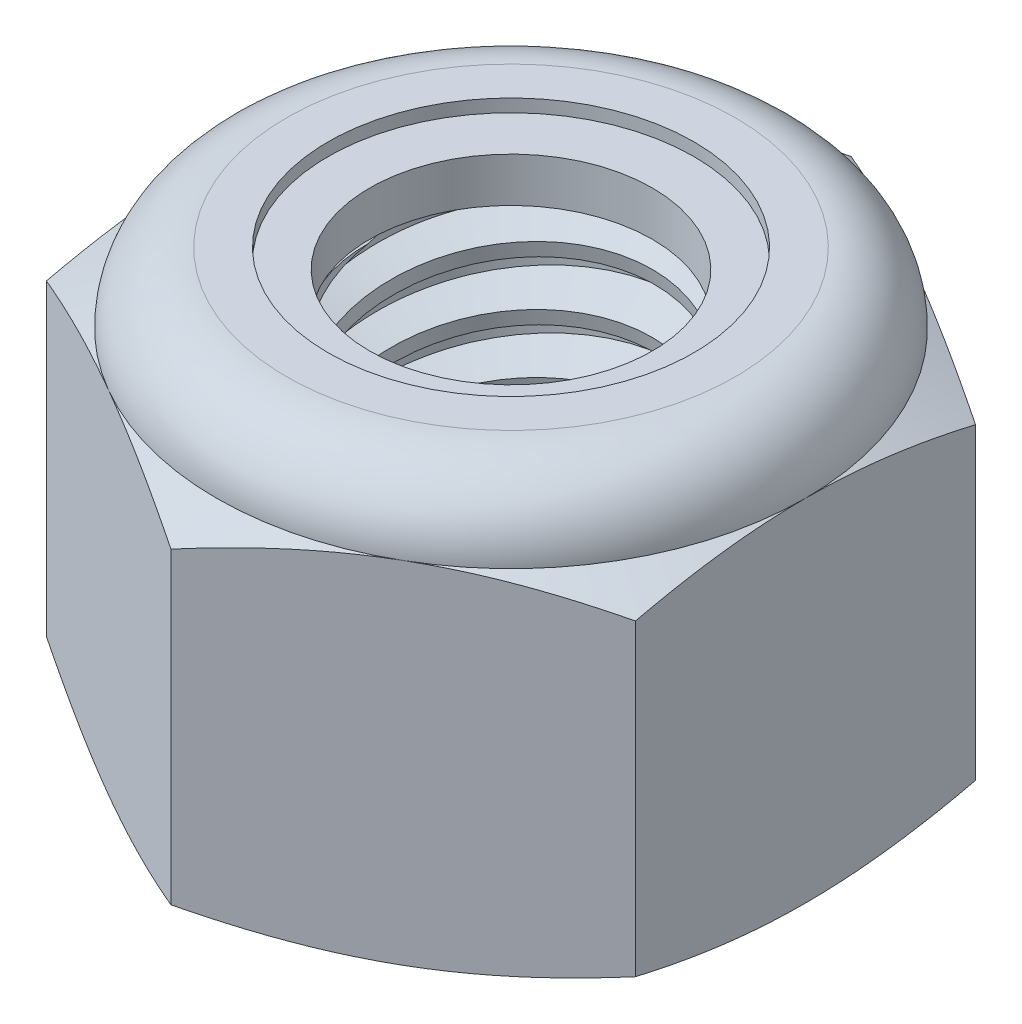
from build123d import *

# Parameters (mm, degrees)
EXTRUDE1_DEPTH       = 5
SKETCH2_W            = 2
SKETCH2_H            = 5
LPATTERN1_COUNT      = 7
LPATTERN1_PITCH      = 0.7
LPATTERN1_COUNT_DIR2 = 2
LPATTERN1_PITCH_DIR2 = 0.7


with BuildPart() as part:
    # Sketch1 → Extrude1 (new body)
    with BuildSketch(Plane(origin=(0, 0, 0), x_dir=(1, 0, 0), z_dir=(0, 1, 0))):
        Polygon((0, 4.041451884), (-3.5, 2.020725942), (-3.5, -2.020725942), (0, -4.041451884), (3.5, -2.020725942), (3.5, 2.020725942), align=None)
    extrude(amount=EXTRUDE1_DEPTH)

    # Sketch4 → Cut-Revolve2 (revolve, cut)
    with BuildSketch(Plane(origin=(0, 0, 0), x_dir=(0, 0, -1), z_dir=(1, 0, 0))):
        Polygon((0, 5), (2, 5), (1.679577111, 4.850584353), (1.679577111, 0.149415647), (2, 0), (0, 0), align=None)
    revolve(axis=Axis((0, 5, 0), (0, 1, 0)), mode=Mode.SUBTRACT)


with BuildPart() as body_2:
    # Sketch2 → Revolve1 (revolve)
    with BuildSketch(Plane(origin=(0, 0, 0), x_dir=(0, 0, -1), z_dir=(1, 0, 0))):
        with Locations((1, 2.5)):
            Rectangle(SKETCH2_W, SKETCH2_H)
    revolve(axis=Axis((0, -2, 0), (0, 1, 0)))

    # Sketch3 → Cut-Revolve1 (revolve, cut)
    with BuildSketch(Plane(origin=(0, 0, 0), x_dir=(0, 0, -1), z_dir=(1, 0, 0))):
        Polygon((2.015083279, 4.913809834), (2.120666232, 4.310478673), (1.709743669, 4.460641574), (1.679577111, 4.633021905), align=None)
    cut_revolve1 = revolve(axis=Axis((0, 5, 0.13120342), (0, -0.9850304671557042, -0.17238033175224862)), mode=Mode.SUBTRACT)

    # LPattern1: Cut-Revolve1 7 × 2
    with Locations(*[Vector(0, -1, 0) * (i * LPATTERN1_PITCH) + Vector(0, 1, 0) * (j * LPATTERN1_PITCH_DIR2) for i in range(LPATTERN1_COUNT) for j in range(LPATTERN1_COUNT_DIR2) if (i, j) != (0, 0)]):
        add(cut_revolve1, mode=Mode.SUBTRACT)


with BuildPart() as part_1:
    add(part.part)

    # Combine1: cut body 2
    add(body_2.part, mode=Mode.SUBTRACT)

    # Sketch5 → Cut-Revolve3 (revolve, cut)
    with BuildSketch(Plane(origin=(0, 0, 0), x_dir=(0, 0, -1), z_dir=(1, 0, 0))):
        with BuildLine():
            Line((0, 0), (3.5, 0))
            Line((3.5, 0), (4.041451884, 0.25248316))
            Line((4.041451884, 0.25248316), (4.041451884, 3.914183506))
            Line((4.041451884, 3.914183506), (3.5, 4.166666667))
            ThreePointArc((3.5, 4.166666667), (3.255922318, 4.755922318), (2.666666667, 5))
            Line((2.666666667, 5), (2.666666667, 6.27))
            Line((2.666666667, 6.27), (5.311451884, 6.27))
            Line((5.311451884, 6.27), (5.311451884, -1.27))
            Line((5.311451884, -1.27), (0, -1.27))
            Line((0, -1.27), (0, 0))
        make_face()
    revolve(axis=Axis((0, 0, 0), (0, 1, 0)), mode=Mode.SUBTRACT)

    # Sketch6 → Cut-Revolve4 (revolve, cut)
    with BuildSketch(Plane(origin=(0, 0, 0), x_dir=(0, 0, -1), z_dir=(1, 0, 0))):
        with BuildLine():
            Line((0, 4.166666667), (3.3476, 4.166666667))
            ThreePointArc((3.3476, 4.166666667), (3.148159244, 4.648159244), (2.666666667, 4.8476))
            Line((2.666666667, 4.8476), (2.173121889, 4.8476))
            Line((2.173121889, 4.8476), (2.173121889, 6.27))
            Line((2.173121889, 6.27), (0, 6.27))
            Line((0, 6.27), (0, 4.166666667))
        make_face()
    revolve(axis=Axis((0, 6.27, 0), (0, 1, 0)), mode=Mode.SUBTRACT)


with BuildPart() as body_2_2:
    # Sketch7 → Revolve2 (revolve)
    with BuildSketch(Plane(origin=(0, 0, 0), x_dir=(0, 0, -1), z_dir=(1, 0, 0))):
        with BuildLine():
            Line((1.679577111, 4.242866667), (3.266579964, 4.242866667))
            ThreePointArc((3.266579964, 4.242866667), (3.066430175, 4.620419399), (2.666666667, 4.7714))
            Line((2.666666667, 4.7714), (1.679577111, 4.7714))
            Line((1.679577111, 4.7714), (1.679577111, 4.242866667))
        make_face()
    revolve(axis=Axis((0, 4.242866667, 0), (0, 1, 0)))


solid = Compound([part_1.part, body_2_2.part])
